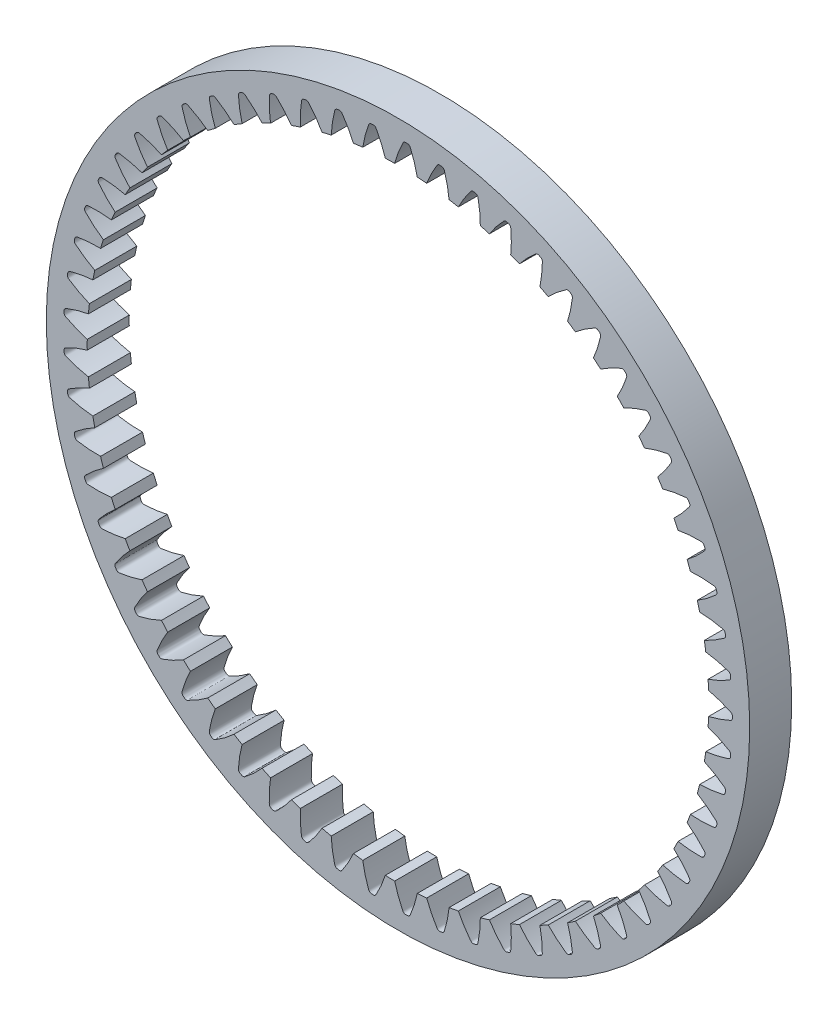
from build123d import *

# Parameters (mm, degrees)
SKETCHREVOLVESPURGEAR_W       = 4
SKETCHREVOLVESPURGEAR_H       = 3.899999985
TOOTHEXTRUDECUTSPURGEAR_DEPTH = 2
PATTERNSPURGEAR_COUNT         = 61


with BuildPart() as part:
    # SketchRevolveSpurGear → SpurGear (revolve)
    with BuildSketch(Plane(origin=(0, 0, 0), x_dir=(0, 0, -1), z_dir=(1, 0, 0))):
        with Locations((0, 31.54999955)):
            Rectangle(SKETCHREVOLVESPURGEAR_W, SKETCHREVOLVESPURGEAR_H)
    revolve(axis=Axis((0, 0, 0), (0, 0, -1)))

    # SketchToothSpurGear → ToothExtrudeCutSpurGear (cut, symmetric)
    with BuildSketch(Plane.XY):
        with BuildLine():
            ThreePointArc((29.561899965, -1.079326439), (29.581596899, 0), (29.561899965, 1.079326439))
            add(Edge.make_bspline(
                [(29.561899965, 1.079326439), (29.673195227, 1.055167196), (29.845740062, 1.013527141), (30.082458484, 0.948562023), (30.277981813, 0.890358107), (30.484835794, 0.823900708), (30.70276782, 0.748717332), (30.931419832, 0.66413836), (31.170776455, 0.570335147), (31.41935673, 0.464128559), (31.603637048, 0.388007897), (31.713618985, 0.331288205), (31.748059448, 0.304877742), (31.77824591, 0.274521602), (31.803778594, 0.240105081), (31.82413073, 0.202423459), (31.84390805, 0.149420693), (31.850751828, 0.093781483), (31.849815044, 0.039561756), (31.850091763, 0), (31.849815044, -0.039561756), (31.850751828, -0.093781483), (31.84390805, -0.149420693), (31.82413073, -0.202423459), (31.803778594, -0.240105081), (31.77824591, -0.274521602), (31.748059448, -0.304877742), (31.713618985, -0.331288205), (31.603637048, -0.388007897), (31.41935673, -0.464128559), (31.170776455, -0.570335147), (30.931419832, -0.66413836), (30.70276782, -0.748717332), (30.484835794, -0.823900708), (30.277981813, -0.890358107), (30.082458484, -0.948562023), (29.845740062, -1.013527141), (29.673195227, -1.055167196), (29.561899965, -1.079326439)],
                knots=[0, 0, 0, 0, 0.064236715, 0.100096133, 0.13844959, 0.179297087, 0.222638623, 0.2684742, 0.316803816, 0.367627472, 0.420945168, 0.429252061, 0.437279486, 0.445306911, 0.453334337, 0.461361762, 0.469389187, 0.485125926, 0.492562969, 0.5, 0.507437031, 0.514874074, 0.530610813, 0.538638238, 0.546665663, 0.554693089, 0.562720514, 0.570747939, 0.579054832, 0.632372528, 0.683196184, 0.7315258, 0.777361377, 0.820702913, 0.86155041, 0.899903867, 0.935763285, 1, 1, 1, 1], degree=3))
        make_face()
    toothextrudecutspurgear = extrude(amount=TOOTHEXTRUDECUTSPURGEAR_DEPTH, both=True, mode=Mode.SUBTRACT)

    # PatternSpurGear: ToothExtrudeCutSpurGear ×61 about axis
    patternspurgear_axis = Axis((0, 0, 55), (0, 0, -1))
    for i in range(1, PATTERNSPURGEAR_COUNT):
        add(toothextrudecutspurgear.rotate(patternspurgear_axis, i * 360 / PATTERNSPURGEAR_COUNT), mode=Mode.SUBTRACT)


solid = part.part
